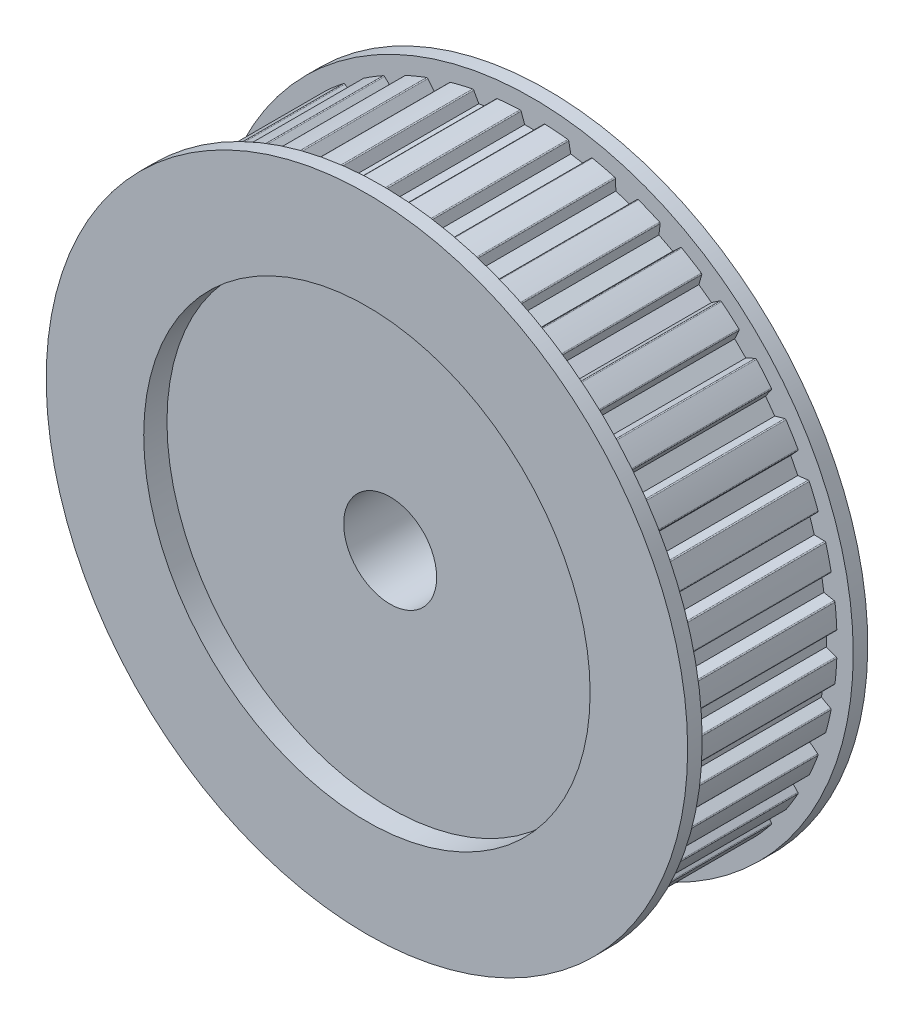
from build123d import *

# Parameters (mm, degrees)
SKETCH1_W               = 63.5
SKETCH1_H               = 1.984375
BOSS_EXTRUDE1_DEPTH     = 20.6375
BOSS_EXTRUDE2_START     = -1.984375
SKETCH3_R               = 63.5
BOSS_EXTRUDE2_DEPTH     = 1.984375
HOLE1_D                 = 88.382475
HOLE1_DEPTH             = 9.921875
HOLE2_D                 = 88.382475
HOLE2_DEPTH             = 9.921875
FILLET1_R               = 0.2286
CUT_EXTRUDE1_DEPTH      = 20.6502
CIRPATTERN2_COUNT       = 40
SCALE1_SCALE_X          = 2.3
SCALE1_SCALE_Y          = 2.3
SCALE1_SCALE_Z          = 1
CUT_EXTRUDE2_DEPTH      = 207.911990821
CUT_EXTRUDE2_DEPTH_BACK = 207.911990821
SKETCH13_R              = 6.35
SCALE2_SCALE_X          = 0.3
SCALE2_SCALE_Y          = 0.3
SCALE2_SCALE_Z          = 1
BOSS_EXTRUDE3_START     = -3.175
SKETCH14_R              = 30.491953875
BOSS_EXTRUDE3_DEPTH     = 18.25625
SKETCH15_R              = 6.35
CUT_EXTRUDE3_DEPTH      = 67.6706533


with BuildPart() as part:
    # Sketch1 → Revolve1 (revolve)
    with BuildSketch(Plane(origin=(0, 0, 0), x_dir=(1, 0, 0), z_dir=(0, 1, 0))):
        with Locations((31.75, -11.3109375)):
            Rectangle(SKETCH1_W, SKETCH1_H)
    revolve(axis=Axis((0, 0, 10.31875), (0, 0, 1)))

    # Sketch2 → Boss-Extrude1 (add)
    with BuildSketch(Plane(origin=(0, 0, 10.31875), x_dir=(-1, 0, 0), z_dir=(0, 0, -1))):
        with BuildLine():
            Line((20.814765597, -56.586407632), (19.445887203, -54.834323187))
            Line((19.445887203, -54.834323187), (16.498753271, -55.791905049))
            Line((16.498753271, -55.791905049), (16.421156785, -58.013977673))
            ThreePointArc((16.421156785, -58.013977673), (-4.730553873, -60.107386032), (-25.294370657, -54.730894462))
            Line((-25.294370657, -54.730894462), (-25.02340306, -52.524040475))
            Line((-25.02340306, -52.524040475), (-27.784454077, -51.117214714))
            Line((-27.784454077, -51.117214714), (-29.410565699, -52.633588333))
            ThreePointArc((-29.410565699, -52.633588333), (-42.633765935, -42.633765935), (-52.633588333, -29.410565699))
            Line((-52.633588333, -29.410565699), (-51.117214714, -27.784454077))
            Line((-51.117214714, -27.784454077), (-52.524040475, -25.02340306))
            Line((-52.524040475, -25.02340306), (-54.730894462, -25.294370657))
            ThreePointArc((-54.730894462, -25.294370657), (-60.107386032, -4.730553873), (-58.013977673, 16.421156785))
            Line((-58.013977673, 16.421156785), (-55.791905049, 16.498753271))
            Line((-55.791905049, 16.498753271), (-54.834323187, 19.445887203))
            Line((-54.834323187, 19.445887203), (-56.586407632, 20.814765597))
            ThreePointArc((-56.586407632, 20.814765597), (-48.778263896, 35.439483163), (-37.282180065, 47.384755409))
            Line((-37.282180065, 47.384755409), (-35.43887548, 46.141430767))
            Line((-35.43887548, 46.141430767), (-32.931893617, 47.962859707))
            Line((-32.931893617, 47.962859707), (-33.544753177, 50.100154988))
            ThreePointArc((-33.544753177, 50.100154988), (-14.075179684, 58.627342703), (7.143599533, 59.868564216))
            Line((7.143599533, 59.868564216), (7.56784942, 57.685987758))
            Line((7.56784942, 57.685987758), (10.62849805, 57.201228638))
            Line((10.62849805, 57.201228638), (11.706436886, 59.145881776))
            ThreePointArc((11.706436886, 59.145881776), (27.372562698, 53.721679115), (40.969152545, 44.235783426))
            Line((40.969152545, 44.235783426), (40.02949166, 42.220674153))
            Line((40.02949166, 42.220674153), (42.220674153, 40.02949166))
            Line((42.220674153, 40.02949166), (44.235783426, 40.969152545))
            ThreePointArc((44.235783426, 40.969152545), (53.721679115, 27.372562698), (59.145881776, 11.706436886))
            Line((59.145881776, 11.706436886), (57.201228638, 10.62849805))
            Line((57.201228638, 10.62849805), (57.685987758, 7.56784942))
            Line((57.685987758, 7.56784942), (59.868564216, 7.143599533))
            ThreePointArc((59.868564216, 7.143599533), (58.627342703, -14.075179684), (50.100154988, -33.544753177))
            Line((50.100154988, -33.544753177), (47.962859707, -32.931893617))
            Line((47.962859707, -32.931893617), (46.141430767, -35.43887548))
            Line((46.141430767, -35.43887548), (47.384755409, -37.282180065))
            ThreePointArc((47.384755409, -37.282180065), (35.439483163, -48.778263896), (20.814765597, -56.586407632))
        make_face()
    extrude(amount=BOSS_EXTRUDE1_DEPTH)

    # Sketch3 → Boss-Extrude2 (add)
    with BuildSketch(Plane.XY.offset(-10.31875).offset(BOSS_EXTRUDE2_START)):
        Circle(SKETCH3_R)
    extrude(amount=BOSS_EXTRUDE2_DEPTH)

    # Hole1
    with Locations(Plane(origin=(0, 0, -12.303125), x_dir=(-1, 0, 0), z_dir=(0, 0, -1))):
        with Locations((0, 0)):
            Hole(HOLE1_D / 2, depth=HOLE1_DEPTH)

    # Hole2
    with Locations(Plane.XY.offset(12.303125)):
        with Locations((0, 0)):
            Hole(HOLE2_D / 2, depth=HOLE2_DEPTH)

    # Fillet1
    fillet1_edges = [part.edges().sort_by_distance(p)[0] for p in [
        (-20.814765597, -56.586407632, 0),
        (-47.384755409, -37.282180065, 0),
        (-50.100154988, -33.544753177, 0),
        (-59.868564216, 7.143599533, 0),
        (-59.145881776, 11.706436886, 0),
        (-44.235783426, 40.969152545, 0),
        (-40.969152545, 44.235783426, 0),
        (-11.706436886, 59.145881776, 0),
        (-7.143599533, 59.868564216, 0),
        (33.544753177, 50.100154988, 0),
        (37.282180065, 47.384755409, 0),
        (56.586407632, 20.814765597, 0),
        (58.013977673, 16.421156785, 0),
        (54.730894462, -25.294370657, 0),
        (52.633588333, -29.410565699, 0),
        (29.410565699, -52.633588333, 0),
        (25.294370657, -54.730894462, 0),
        (-16.421156785, -58.013977673, 0),
    ]]
    fillet(fillet1_edges, radius=FILLET1_R)

    # Sketch12 → Cut-Extrude1 (cut)
    with BuildSketch(Plane.XY.offset(-10.31875)):
        with BuildLine():
            Line((35.43887548, 46.141430767), (37.143791211, 47.291410948))
            ThreePointArc((37.143791211, 47.291410948), (37.280307439, 47.330327929), (37.413474745, 47.281158013))
            ThreePointArc((37.413474745, 47.281158013), (35.439530543, 48.778329109), (33.405653911, 50.193010293))
            ThreePointArc((33.405653911, 50.193010293), (33.493568241, 50.081554999), (33.498741827, 49.939694342))
            Line((33.498741827, 49.939694342), (32.931893617, 47.962859707))
            Line((32.931893617, 47.962859707), (35.43887548, 46.141430767))
        make_face()
    cut_extrude1 = extrude(amount=CUT_EXTRUDE1_DEPTH, mode=Mode.SUBTRACT)

    # CirPattern2: Cut-Extrude1 ×40 about axis
    cirpattern2_axis = Axis((0, 0, 0), (0, 0, 1))
    for i in range(1, CIRPATTERN2_COUNT):
        add(cut_extrude1.rotate(cirpattern2_axis, i * 360 / CIRPATTERN2_COUNT), mode=Mode.SUBTRACT)


with BuildPart() as part_1:
    # Scale1: scaled about (0, 0, 0)
    add(part.part.scale((SCALE1_SCALE_X, SCALE1_SCALE_Y, SCALE1_SCALE_Z), about=(0, 0, 0)))

    # Sketch13 → Cut-Extrude2 (cut, two sides: drawn at the far end of the back side and taken through both)
    with BuildSketch(Plane.XY.offset(-CUT_EXTRUDE2_DEPTH_BACK)):
        Circle(SKETCH13_R)
    extrude(amount=CUT_EXTRUDE2_DEPTH + CUT_EXTRUDE2_DEPTH_BACK, mode=Mode.SUBTRACT)


with BuildPart() as part_2:
    # Scale2: scaled about (0, 0, 0)
    add(part_1.part.scale((SCALE2_SCALE_X, SCALE2_SCALE_Y, SCALE2_SCALE_Z), about=(0, 0, 0)))

    # Sketch14 → Boss-Extrude3 (add)
    with BuildSketch(Plane.XY.offset(12.303125).offset(BOSS_EXTRUDE3_START)):
        with Locations(Location((0, 0, 0), (0, 0, 180))):
            Circle(SKETCH14_R)
    extrude(amount=-BOSS_EXTRUDE3_DEPTH)

    # Sketch15 → Cut-Extrude3 (cut, through all)
    with BuildSketch(Plane.XY.offset(12.303125)):
        Circle(SKETCH15_R)
    extrude(amount=-CUT_EXTRUDE3_DEPTH, mode=Mode.SUBTRACT)


solid = part_2.part
